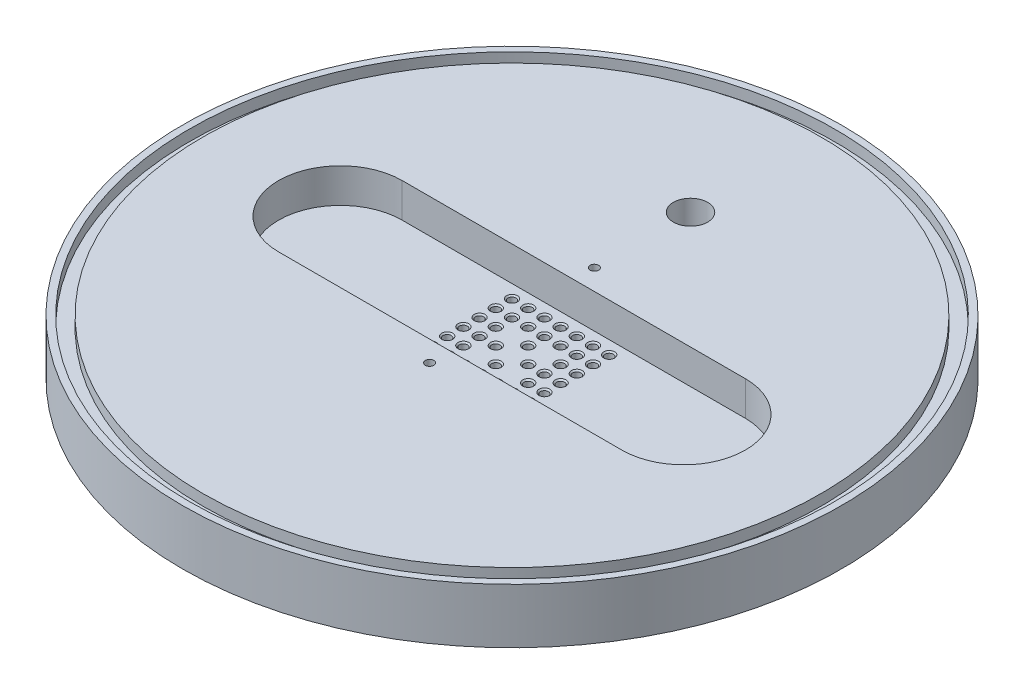
from build123d import *

# Parameters (mm, degrees)
SKETCH1_R                               = 60.96
BILLET_DEPTH                            = 10.16
KEROSENE_WELL_DEPTH                     = 6.35
FIRST_KEROSENE_OUTLET_REACH             = 88.807
SKETCH4_R                               = 0.7493
BOTTOM_NEEDLE_CHAMFER_SIZE              = 0.254
LPATTERN1_COUNT                         = 7
LPATTERN1_PITCH                         = 2.9972
LPATTERN1_COUNT_DIR2                    = 7
LPATTERN1_PITCH_DIR2                    = 2.9972
BOTTOM_NEEDLE_CHAMFER_OF_LPATTERN1_SIZE = 0.254
SKETCH13_R                              = 0.79375
DOWEL_HOLES_DEPTH                       = 3.175
MANIFOLD_HOLE_REACH                     = 88.807
SKETCH14_R                              = 3.175
SKETCH15_R                              = 59.69
SKETCH15_R_2                            = 57.15
CHAMBER_O_RING_DEPTH                    = 2.032
TOP_START                               = -2.032
SKETCH16_R                              = 59.69
SKETCH16_R_2                            = 57.15
TOP_O_RING_DEPTH                        = 2.032


with BuildPart() as part:
    # Sketch1 → Billet (new body)
    with BuildSketch(Plane(origin=(0, 0, 0), x_dir=(1, 0, 0), z_dir=(0, 1, 0))):
        Circle(SKETCH1_R)
    extrude(amount=-BILLET_DEPTH)

    # Sketch2 → Kerosene Well (cut)
    with BuildSketch(Plane(origin=(0, 0, 0), x_dir=(1, 0, 0), z_dir=(0, 1, 0))):
        with BuildLine():
            Line((-31.75, 11.43), (31.75, 11.43))
            ThreePointArc((31.75, 11.43), (43.18, 0), (31.75, -11.43))
            Line((31.75, -11.43), (-31.75, -11.43))
            ThreePointArc((-31.75, -11.43), (-43.18, 0), (-31.75, 11.43))
        make_face()
    extrude(amount=-KEROSENE_WELL_DEPTH, mode=Mode.SUBTRACT)

    # Sketch4 → First Kerosene Outlet (cut, up to next)
    with BuildSketch(Plane(origin=(0, -10.16, 0), x_dir=(1, 0, 0), z_dir=(0, 1, 0)), mode=Mode.PRIVATE) as first_kerosene_outlet_sk1:
        with Locations((8.9916, 8.9916)):
            Circle(SKETCH4_R)
    first_kerosene_outlet_tool1 = extrude(first_kerosene_outlet_sk1.sketch, amount=FIRST_KEROSENE_OUTLET_REACH, mode=Mode.PRIVATE) & part.part
    first_kerosene_outlet = first_kerosene_outlet_tool1.solids().sort_by_distance((8.9916, -10.16, -8.9916))[0]
    add(first_kerosene_outlet, mode=Mode.SUBTRACT)

    # Bottom Needle Chamfer
    bottom_needle_chamfer_edges = [part.edges().sort_by_distance(p)[0] for p in [
        (8.2423, -6.35, -8.9916),
    ]]
    chamfer(bottom_needle_chamfer_edges, length=BOTTOM_NEEDLE_CHAMFER_SIZE)

    # LPattern1: First Kerosene Outlet 7 × 7, 5 skipped
    with Locations(*[(-j * LPATTERN1_PITCH_DIR2, 0, i * LPATTERN1_PITCH) for i in range(LPATTERN1_COUNT) for j in range(LPATTERN1_COUNT_DIR2) if (i, j) not in ((0, 0), (2, 2), (2, 4), (3, 3), (4, 2), (4, 4))]):
        add(first_kerosene_outlet, mode=Mode.SUBTRACT)

    # Bottom Needle Chamfer of LPattern1
    bottom_needle_chamfer_of_lpattern1_edges = [part.edges().sort_by_distance(p)[0] for p in [
        (5.2451, -6.35, -8.9916),
        (2.2479, -6.35, -8.9916),
        (-0.7493, -6.35, -8.9916),
        (-3.7465, -6.35, -8.9916),
        (-6.7437, -6.35, -8.9916),
        (-9.7409, -6.35, -8.9916),
        (8.2423, -6.35, -5.9944),
        (5.2451, -6.35, -5.9944),
        (2.2479, -6.35, -5.9944),
        (-0.7493, -6.35, -5.9944),
        (-3.7465, -6.35, -5.9944),
        (-6.7437, -6.35, -5.9944),
        (-9.7409, -6.35, -5.9944),
        (8.2423, -6.35, -2.9972),
        (5.2451, -6.35, -2.9972),
        (-0.7493, -6.35, -2.9972),
        (-6.7437, -6.35, -2.9972),
        (-9.7409, -6.35, -2.9972),
        (8.2423, -6.35, 0),
        (5.2451, -6.35, 0),
        (2.2479, -6.35, 0),
        (-3.7465, -6.35, 0),
        (-6.7437, -6.35, 0),
        (-9.7409, -6.35, 0),
        (8.2423, -6.35, 2.9972),
        (5.2451, -6.35, 2.9972),
        (-0.7493, -6.35, 2.9972),
        (-6.7437, -6.35, 2.9972),
        (-9.7409, -6.35, 2.9972),
        (8.2423, -6.35, 5.9944),
        (5.2451, -6.35, 5.9944),
        (2.2479, -6.35, 5.9944),
        (-0.7493, -6.35, 5.9944),
        (-3.7465, -6.35, 5.9944),
        (-6.7437, -6.35, 5.9944),
        (-9.7409, -6.35, 5.9944),
        (8.2423, -6.35, 8.9916),
        (5.2451, -6.35, 8.9916),
        (2.2479, -6.35, 8.9916),
        (-0.7493, -6.35, 8.9916),
        (-3.7465, -6.35, 8.9916),
        (-6.7437, -6.35, 8.9916),
        (-9.7409, -6.35, 8.9916),
    ]]
    chamfer(bottom_needle_chamfer_of_lpattern1_edges, length=BOTTOM_NEEDLE_CHAMFER_OF_LPATTERN1_SIZE)

    # Sketch13 → Dowel Holes (cut)
    with BuildSketch(Plane(origin=(0, 0, 0), x_dir=(1, 0, 0), z_dir=(0, 1, 0))):
        with Locations((0, 15.24)):
            Circle(SKETCH13_R)
        with Locations((0, -15.24)):
            Circle(SKETCH13_R)
    extrude(amount=-DOWEL_HOLES_DEPTH, mode=Mode.SUBTRACT)

    # Sketch14 → Manifold Hole (cut, up to next)
    with BuildSketch(Plane(origin=(0, 0, 0), x_dir=(1, 0, 0), z_dir=(0, 1, 0)), mode=Mode.PRIVATE) as manifold_hole_sk1:
        with Locations((0, 33.02)):
            Circle(SKETCH14_R)
    manifold_hole_tool1 = extrude(manifold_hole_sk1.sketch, amount=-MANIFOLD_HOLE_REACH, mode=Mode.PRIVATE) & part.part
    add(manifold_hole_tool1.solids().sort_by_distance((0, 0, -33.02))[0], mode=Mode.SUBTRACT)

    # Sketch15 → Chamber O Ring (cut)
    with BuildSketch(Plane(origin=(0, -10.16, 0), x_dir=(1, 0, 0), z_dir=(0, 1, 0))):
        Circle(SKETCH15_R)
        Circle(SKETCH15_R_2, mode=Mode.SUBTRACT)
    extrude(amount=CHAMBER_O_RING_DEPTH, mode=Mode.SUBTRACT)

    # Sketch16 → Top O ring (cut)
    with BuildSketch(Plane(origin=(0, 0, 0), x_dir=(1, 0, 0), z_dir=(0, 1, 0)).offset(TOP_START)):
        Circle(SKETCH16_R)
        Circle(SKETCH16_R_2, mode=Mode.SUBTRACT)
    extrude(amount=TOP_O_RING_DEPTH, mode=Mode.SUBTRACT)


solid = part.part
